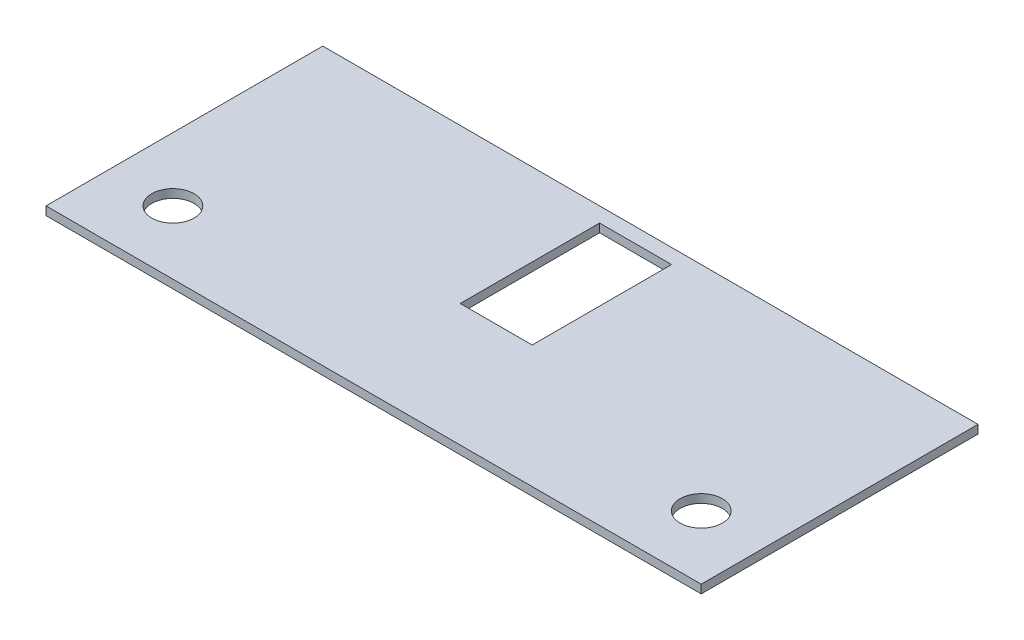
from build123d import *

# Parameters (mm, degrees)
SKETCH_1_W          = 154.889723794
SKETCH_1_H          = 65.431275614
SKETCH_1_W_2        = 17
SKETCH_1_H_2        = 32.940924084
EXTRUDE_1_DEPTH     = 2
SKETCH_2_R          = 5
CUT_EXTRUDE_2_DEPTH = 90.609556274


with BuildPart() as part:
    # Эскиз1 → Вытянуть1 (new body)
    with BuildSketch(Plane(origin=(0, 0, 0), x_dir=(1, 0, 0), z_dir=(0, 1, 0))):
        with Locations((0, -12.319525582)):
            Rectangle(SKETCH_1_W, SKETCH_1_H)
        with Locations((0, 0.417277171)):
            Rectangle(SKETCH_1_W_2, SKETCH_1_H_2, mode=Mode.SUBTRACT)
    extrude(amount=EXTRUDE_1_DEPTH)

    # Эскиз2 → Вытянуть2 (cut, through all)
    with BuildSketch(Plane(origin=(0, 2, 0), x_dir=(1, 0, 0), z_dir=(0, 1, 0))):
        with Locations((-62.444861897, -30.035163389)):
            Circle(SKETCH_2_R)
        with Locations((62.444861897, -30.035163389)):
            Circle(SKETCH_2_R)
    extrude(amount=-CUT_EXTRUDE_2_DEPTH, mode=Mode.SUBTRACT)


solid = part.part
